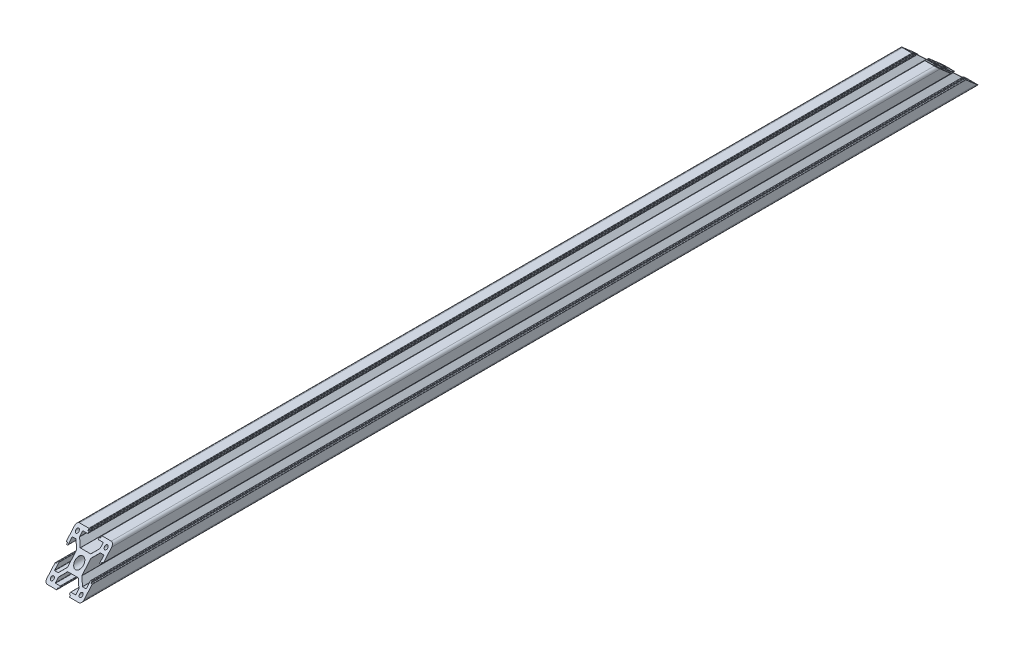
from build123d import *

# Parameters (mm, degrees)
CROQUIS1_R              = 1.25
CROQUIS1_R_2            = 3.4
SALIENTE_EXTRUIR1_DEPTH = 725
CUT_EXTRUDE1_DEPTH      = 726.310278433
CUT_EXTRUDE1_DEPTH_BACK = 726.310278433


with BuildPart() as part:
    # Croquis1 → Saliente-Extruir1 (new body)
    with BuildSketch(Plane.XY):
        with BuildLine():
            Line((-4.161522369, 5.8), (4.161522369, 5.8))
            ThreePointArc((4.161522369, 5.8), (4.238059055, 5.815224093), (4.302943725, 5.858578644))
            Line((4.302943725, 5.858578644), (8.191421356, 9.747056275))
            ThreePointArc((8.191421356, 9.747056275), (8.234775907, 9.811940945), (8.25, 9.888477631))
            Line((8.25, 9.888477631), (8.25, 12.6))
            ThreePointArc((8.25, 12.6), (8.191421356, 12.741421356), (8.05, 12.8))
            Line((8.05, 12.8), (4.3, 12.8))
            ThreePointArc((4.3, 12.8), (4.158578644, 12.858578644), (4.1, 13))
            Line((4.1, 13), (4.1, 13.7))
            ThreePointArc((4.1, 13.7), (4.158578644, 13.841421356), (4.3, 13.9))
            Line((4.3, 13.9), (4.9, 13.9))
            ThreePointArc((4.9, 13.9), (5.041421356, 13.958578644), (5.1, 14.1))
            Line((5.1, 14.1), (5.1, 14.8))
            ThreePointArc((5.1, 14.8), (5.158578644, 14.941421356), (5.3, 15))
            Line((5.3, 15), (12.8, 15))
            ThreePointArc((12.8, 15), (14.355634919, 14.355634919), (15, 12.8))
            Line((15, 12.8), (15, 5.3))
            ThreePointArc((15, 5.3), (14.941421356, 5.158578644), (14.8, 5.1))
            Line((14.8, 5.1), (13.9, 5.1))
            Line((13.9, 5.1), (13.9, 4.3))
            ThreePointArc((13.9, 4.3), (13.841421356, 4.158578644), (13.7, 4.1))
            Line((13.7, 4.1), (13, 4.1))
            ThreePointArc((13, 4.1), (12.858578644, 4.158578644), (12.8, 4.3))
            Line((12.8, 4.3), (12.8, 8.05))
            ThreePointArc((12.8, 8.05), (12.741421356, 8.191421356), (12.6, 8.25))
            Line((12.6, 8.25), (9.888477631, 8.25))
            ThreePointArc((9.888477631, 8.25), (9.811940945, 8.234775907), (9.747056275, 8.191421356))
            Line((9.747056275, 8.191421356), (5.858578644, 4.302943725))
            ThreePointArc((5.858578644, 4.302943725), (5.815224093, 4.238059055), (5.8, 4.161522369))
            Line((5.8, 4.161522369), (5.8, -4.161522369))
            ThreePointArc((5.8, -4.161522369), (5.815224093, -4.238059055), (5.858578644, -4.302943725))
            Line((5.858578644, -4.302943725), (9.747056275, -8.191421356))
            ThreePointArc((9.747056275, -8.191421356), (9.811940945, -8.234775907), (9.888477631, -8.25))
            Line((9.888477631, -8.25), (12.6, -8.25))
            ThreePointArc((12.6, -8.25), (12.741421356, -8.191421356), (12.8, -8.05))
            Line((12.8, -8.05), (12.8, -4.3))
            ThreePointArc((12.8, -4.3), (12.858578644, -4.158578644), (13, -4.1))
            Line((13, -4.1), (13.7, -4.1))
            ThreePointArc((13.7, -4.1), (13.841421356, -4.158578644), (13.9, -4.3))
            Line((13.9, -4.3), (13.9, -5.1))
            Line((13.9, -5.1), (14.8, -5.1))
            ThreePointArc((14.8, -5.1), (14.941421356, -5.158578644), (15, -5.3))
            Line((15, -5.3), (15, -12.8))
            ThreePointArc((15, -12.8), (14.355634919, -14.355634919), (12.8, -15))
            Line((12.8, -15), (5.3, -15))
            ThreePointArc((5.3, -15), (5.158578644, -14.941421356), (5.1, -14.8))
            Line((5.1, -14.8), (5.1, -14.1))
            ThreePointArc((5.1, -14.1), (5.041421356, -13.958578644), (4.9, -13.9))
            Line((4.9, -13.9), (4.3, -13.9))
            ThreePointArc((4.3, -13.9), (4.158578644, -13.841421356), (4.1, -13.7))
            Line((4.1, -13.7), (4.1, -13))
            ThreePointArc((4.1, -13), (4.158578644, -12.858578644), (4.3, -12.8))
            Line((4.3, -12.8), (8.05, -12.8))
            ThreePointArc((8.05, -12.8), (8.191421356, -12.741421356), (8.25, -12.6))
            Line((8.25, -12.6), (8.25, -9.888477631))
            ThreePointArc((8.25, -9.888477631), (8.234775907, -9.811940945), (8.191421356, -9.747056275))
            Line((8.191421356, -9.747056275), (4.302943725, -5.858578644))
            ThreePointArc((4.302943725, -5.858578644), (4.238059055, -5.815224093), (4.161522369, -5.8))
            Line((4.161522369, -5.8), (-4.161522369, -5.8))
            ThreePointArc((-4.161522369, -5.8), (-4.238059055, -5.815224093), (-4.302943725, -5.858578644))
            Line((-4.302943725, -5.858578644), (-8.191421356, -9.747056275))
            ThreePointArc((-8.191421356, -9.747056275), (-8.234775907, -9.811940945), (-8.25, -9.888477631))
            Line((-8.25, -9.888477631), (-8.25, -12.6))
            ThreePointArc((-8.25, -12.6), (-8.191421356, -12.741421356), (-8.05, -12.8))
            Line((-8.05, -12.8), (-4.3, -12.8))
            ThreePointArc((-4.3, -12.8), (-4.158578644, -12.858578644), (-4.1, -13))
            Line((-4.1, -13), (-4.1, -13.7))
            ThreePointArc((-4.1, -13.7), (-4.158578644, -13.841421356), (-4.3, -13.9))
            Line((-4.3, -13.9), (-4.9, -13.9))
            ThreePointArc((-4.9, -13.9), (-5.041421356, -13.958578644), (-5.1, -14.1))
            Line((-5.1, -14.1), (-5.1, -14.8))
            ThreePointArc((-5.1, -14.8), (-5.158578644, -14.941421356), (-5.3, -15))
            Line((-5.3, -15), (-12.8, -15))
            ThreePointArc((-12.8, -15), (-14.355634919, -14.355634919), (-15, -12.8))
            Line((-15, -12.8), (-15, -5.3))
            ThreePointArc((-15, -5.3), (-14.941421356, -5.158578644), (-14.8, -5.1))
            Line((-14.8, -5.1), (-13.9, -5.1))
            Line((-13.9, -5.1), (-13.9, -4.3))
            ThreePointArc((-13.9, -4.3), (-13.841421356, -4.158578644), (-13.7, -4.1))
            Line((-13.7, -4.1), (-13, -4.1))
            ThreePointArc((-13, -4.1), (-12.858578644, -4.158578644), (-12.8, -4.3))
            Line((-12.8, -4.3), (-12.8, -8.05))
            ThreePointArc((-12.8, -8.05), (-12.741421356, -8.191421356), (-12.6, -8.25))
            Line((-12.6, -8.25), (-9.888477631, -8.25))
            ThreePointArc((-9.888477631, -8.25), (-9.811940945, -8.234775907), (-9.747056275, -8.191421356))
            Line((-9.747056275, -8.191421356), (-5.858578644, -4.302943725))
            ThreePointArc((-5.858578644, -4.302943725), (-5.815224093, -4.238059055), (-5.8, -4.161522369))
            Line((-5.8, -4.161522369), (-5.8, 4.161522369))
            ThreePointArc((-5.8, 4.161522369), (-5.815224093, 4.238059055), (-5.858578644, 4.302943725))
            Line((-5.858578644, 4.302943725), (-9.747056275, 8.191421356))
            ThreePointArc((-9.747056275, 8.191421356), (-9.811940945, 8.234775907), (-9.888477631, 8.25))
            Line((-9.888477631, 8.25), (-12.6, 8.25))
            ThreePointArc((-12.6, 8.25), (-12.741421356, 8.191421356), (-12.8, 8.05))
            Line((-12.8, 8.05), (-12.8, 4.3))
            ThreePointArc((-12.8, 4.3), (-12.858578644, 4.158578644), (-13, 4.1))
            Line((-13, 4.1), (-13.7, 4.1))
            ThreePointArc((-13.7, 4.1), (-13.841421356, 4.158578644), (-13.9, 4.3))
            Line((-13.9, 4.3), (-13.9, 5.1))
            Line((-13.9, 5.1), (-14.8, 5.1))
            ThreePointArc((-14.8, 5.1), (-14.941421356, 5.158578644), (-15, 5.3))
            Line((-15, 5.3), (-15, 12.8))
            ThreePointArc((-15, 12.8), (-14.355634919, 14.355634919), (-12.8, 15))
            Line((-12.8, 15), (-5.3, 15))
            ThreePointArc((-5.3, 15), (-5.158578644, 14.941421356), (-5.1, 14.8))
            Line((-5.1, 14.8), (-5.1, 14.1))
            ThreePointArc((-5.1, 14.1), (-5.041421356, 13.958578644), (-4.9, 13.9))
            Line((-4.9, 13.9), (-4.3, 13.9))
            ThreePointArc((-4.3, 13.9), (-4.158578644, 13.841421356), (-4.1, 13.7))
            Line((-4.1, 13.7), (-4.1, 13))
            ThreePointArc((-4.1, 13), (-4.158578644, 12.858578644), (-4.3, 12.8))
            Line((-4.3, 12.8), (-8.05, 12.8))
            ThreePointArc((-8.05, 12.8), (-8.191421356, 12.741421356), (-8.25, 12.6))
            Line((-8.25, 12.6), (-8.25, 9.888477631))
            ThreePointArc((-8.25, 9.888477631), (-8.234775907, 9.811940945), (-8.191421356, 9.747056275))
            Line((-8.191421356, 9.747056275), (-4.302943725, 5.858578644))
            ThreePointArc((-4.302943725, 5.858578644), (-4.238059055, 5.815224093), (-4.161522369, 5.8))
        make_face()
        with Locations((11.625, 11.625)):
            Circle(CROQUIS1_R, mode=Mode.SUBTRACT)
        with Locations((11.625, -11.625)):
            Circle(CROQUIS1_R, mode=Mode.SUBTRACT)
        with Locations((-11.625, -11.625)):
            Circle(CROQUIS1_R, mode=Mode.SUBTRACT)
        with Locations((-11.625, 11.625)):
            Circle(CROQUIS1_R, mode=Mode.SUBTRACT)
        Circle(CROQUIS1_R_2, mode=Mode.SUBTRACT)
    extrude(amount=SALIENTE_EXTRUIR1_DEPTH)

    # Sketch1 → Cut-Extrude1 (cut, two sides: drawn at the far end of the back side and taken through both)
    with BuildSketch(Plane(origin=(0, 0, 0), x_dir=(0, 0, -1), z_dir=(1, 0, 0)).offset(-CUT_EXTRUDE1_DEPTH_BACK)):
        Polygon((-725, -15), (-698.921397866, 15), (-725, 15), align=None)
        Polygon((0, 15), (0, -15), (-34.511052217, 15), align=None)
    extrude(amount=CUT_EXTRUDE1_DEPTH + CUT_EXTRUDE1_DEPTH_BACK, mode=Mode.SUBTRACT)


solid = part.part
